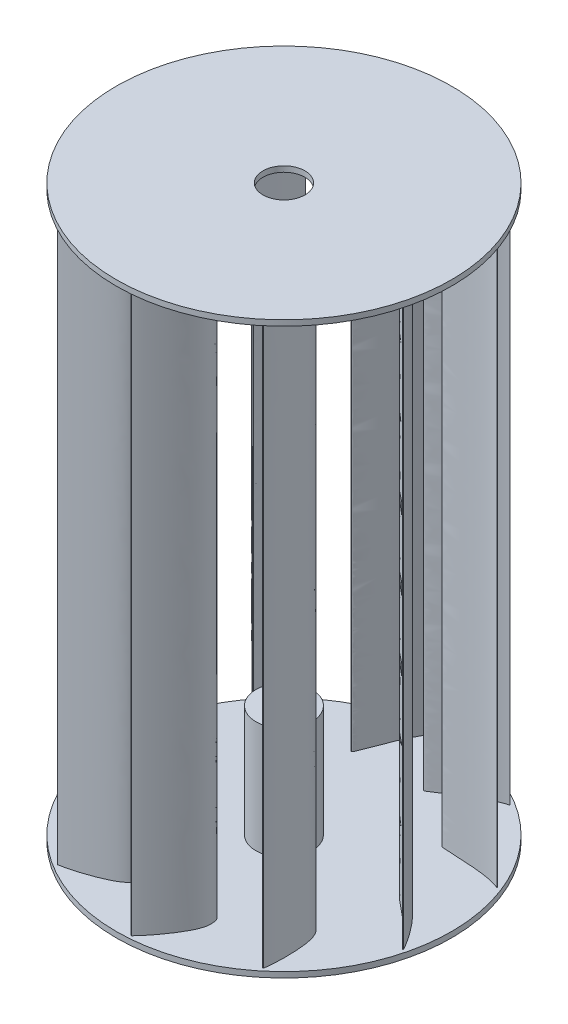
from build123d import *
from build123d.topology import SkipClean

# Parameters (mm, degrees)
SKETCH1_R               = 60
SKETCH1_R_2             = 4.05
BOSS_EXTRUDE1_DEPTH     = 2
BOSS_EXTRUDE3_DEPTH     = 200
SKETCH6_R               = 60
BOSS_EXTRUDE4_DEPTH     = 2
SKETCH5_3_W             = 16.38
SKETCH5_3_H             = 3.2
CUT_EXTRUDE1_DEPTH      = 2
BOSS_EXTRUDE5_START     = -2
BOSS_EXTRUDE5_OUTLINE_R = 10
BOSS_EXTRUDE5_DEPTH     = 21.5
SKETCH8_R               = 10
SKETCH8_R_2             = 4.05
BOSS_EXTRUDE6_DEPTH     = 20.5
SKETCH7_R               = 7.5
CUT_EXTRUDE2_DEPTH      = 2


with BuildPart() as part:
    # Sketch1 → Boss-Extrude1 (new body)
    with BuildSketch(Plane(origin=(0, 0, 0), x_dir=(1, 0, 0), z_dir=(0, 1, 0))):
        with Locations(Location((0, 0, 0), (0, 0, 270))):
            Circle(SKETCH1_R)
        with Locations(Location((0, 0, 0), (0, 0, 270))):
            Circle(SKETCH1_R_2, mode=Mode.SUBTRACT)
    extrude(amount=BOSS_EXTRUDE1_DEPTH)

    # Sketch5 → Boss-Extrude3 (add)
    with BuildSketch(Plane(origin=(0, 2, 0), x_dir=(1, 0, 0), z_dir=(0, 1, 0))):
        with BuildLine():
            Line((54.47988, 21.960658), (54.47988, 21.690876))
            add(Edge.make_bspline(
                [(31.771613, 24.834232), (31.766431, 24.791955), (31.759813, 24.712032), (31.900649, 24.569593), (32.095585, 24.506667), (32.496935, 24.424733), (37.402004, 24.192082), (47.209803, 23.66196), (51.917699, 22.649017), (53.887952, 21.95154), (54.47988, 21.690876)],
                knots=[0.499514, 0.499514, 0.499514, 0.499514, 0.508262, 0.515116, 0.518944, 0.522858, 0.530686, 0.624525, 0.81222, 0.898706, 0.898706, 0.898706, 0.898706], degree=3))
            add(Edge.make_bspline(
                [(54.47988, 21.960658), (54.371607, 22.017615), (53.429721, 22.499693), (50.737589, 23.658763), (44.529731, 25.7581), (38.137513, 27.152008), (34.495208, 26.829661), (32.006302, 25.472619), (31.803699, 25.09602), (31.771613, 24.834232)],
                knots=[0.027203, 0.027203, 0.027203, 0.027203, 0.031297, 0.062601, 0.125217, 0.250445, 0.375468, 0.445342, 0.499514, 0.499514, 0.499514, 0.499514], degree=3))
        make_face()
        with BuildLine():
            Line((31.166998, 49.789016), (31.325572, 49.570757))
            add(Edge.make_bspline(
                [(11.106579, 38.766201), (11.127237, 38.728953), (11.16886, 38.660403), (11.366523, 38.627949), (11.561216, 38.691621), (11.934075, 38.861243), (16.039108, 41.556151), (24.285382, 46.892154), (28.689543, 48.839898), (30.693478, 49.433713), (31.325572, 49.570757)],
                knots=[0.499514, 0.499514, 0.499514, 0.499514, 0.508262, 0.515116, 0.518944, 0.522858, 0.530686, 0.624525, 0.81222, 0.898706, 0.898706, 0.898706, 0.898706], degree=3))
            add(Edge.make_bspline(
                [(31.166998, 49.789016), (31.045925, 49.771453), (30.000565, 49.607836), (27.1413, 48.963148), (20.885078, 47.01266), (14.894346, 44.383104), (12.137131, 41.981426), (10.921213, 39.420614), (10.978663, 38.996852), (11.106579, 38.766201)],
                knots=[0.027203, 0.027203, 0.027203, 0.027203, 0.031297, 0.062601, 0.125217, 0.250445, 0.375468, 0.445342, 0.499514, 0.499514, 0.499514, 0.499514], degree=3))
        make_face()
        with BuildLine():
            Line((-4.050618, 58.599662), (-3.79404, 58.516294))
            add(Edge.make_bspline(
                [(-13.80079, 37.890799), (-13.762184, 37.872807), (-13.688217, 37.841815), (-13.509228, 37.931742), (-13.389144, 38.097692), (-13.187196, 38.454079), (-11.450182, 43.047184), (-7.915229, 52.211139), (-5.497044, 56.375597), (-4.224862, 58.033887), (-3.79404, 58.516294)],
                knots=[0.499514, 0.499514, 0.499514, 0.499514, 0.508262, 0.515116, 0.518944, 0.522858, 0.530686, 0.624525, 0.81222, 0.898706, 0.898706, 0.898706, 0.898706], degree=3))
            add(Edge.make_bspline(
                [(-4.050618, 58.599662), (-4.138246, 58.514288), (-4.887788, 57.767472), (-6.822043, 55.565274), (-10.736965, 50.309982), (-14.037954, 44.661362), (-14.856918, 41.097714), (-14.335409, 38.311275), (-14.03985, 38.002212), (-13.80079, 37.890799)],
                knots=[0.027203, 0.027203, 0.027203, 0.027203, 0.031297, 0.062601, 0.125217, 0.250445, 0.375468, 0.445342, 0.499514, 0.499514, 0.499514, 0.499514], degree=3))
        make_face()
        with BuildLine():
            Line((-54.47988, -21.960658), (-54.47988, -21.690876))
            add(Edge.make_bspline(
                [(-31.771613, -24.834232), (-31.766431, -24.791955), (-31.759813, -24.712032), (-31.900649, -24.569593), (-32.095585, -24.506667), (-32.496935, -24.424733), (-37.402004, -24.192082), (-47.209803, -23.66196), (-51.917699, -22.649017), (-53.887952, -21.95154), (-54.47988, -21.690876)],
                knots=[0.499514, 0.499514, 0.499514, 0.499514, 0.508262, 0.515116, 0.518944, 0.522858, 0.530686, 0.624525, 0.81222, 0.898706, 0.898706, 0.898706, 0.898706], degree=3))
            add(Edge.make_bspline(
                [(-54.47988, -21.960658), (-54.371607, -22.017615), (-53.429721, -22.499693), (-50.737589, -23.658763), (-44.529731, -25.7581), (-38.137513, -27.152008), (-34.495208, -26.829661), (-32.006302, -25.472619), (-31.803699, -25.09602), (-31.771613, -24.834232)],
                knots=[0.027203, 0.027203, 0.027203, 0.027203, 0.031297, 0.062601, 0.125217, 0.250445, 0.375468, 0.445342, 0.499514, 0.499514, 0.499514, 0.499514], degree=3))
        make_face()
        with BuildLine():
            Line((-31.166998, -49.789016), (-31.325572, -49.570757))
            add(Edge.make_bspline(
                [(-11.106579, -38.766201), (-11.127237, -38.728953), (-11.16886, -38.660403), (-11.366523, -38.627949), (-11.561216, -38.691621), (-11.934075, -38.861243), (-16.039108, -41.556151), (-24.285382, -46.892154), (-28.689543, -48.839898), (-30.693478, -49.433713), (-31.325572, -49.570757)],
                knots=[0.499514, 0.499514, 0.499514, 0.499514, 0.508262, 0.515116, 0.518944, 0.522858, 0.530686, 0.624525, 0.81222, 0.898706, 0.898706, 0.898706, 0.898706], degree=3))
            add(Edge.make_bspline(
                [(-31.166998, -49.789016), (-31.045925, -49.771453), (-30.000565, -49.607836), (-27.1413, -48.963148), (-20.885078, -47.01266), (-14.894346, -44.383104), (-12.137131, -41.981426), (-10.921213, -39.420614), (-10.978663, -38.996852), (-11.106579, -38.766201)],
                knots=[0.027203, 0.027203, 0.027203, 0.027203, 0.031297, 0.062601, 0.125217, 0.250445, 0.375468, 0.445342, 0.499514, 0.499514, 0.499514, 0.499514], degree=3))
        make_face()
        with BuildLine():
            Line((37.721036, -45.027228), (37.464457, -45.110596))
            add(Edge.make_bspline(
                [(33.436726, -22.5424), (33.394918, -22.550536), (33.316861, -22.568939), (33.224914, -22.746899), (33.225306, -22.951738), (33.271406, -23.358764), (34.565892, -28.095655), (37.092492, -37.587243), (37.583947, -42.377735), (37.529448, -44.467089), (37.464457, -45.110596)],
                knots=[0.499514, 0.499514, 0.499514, 0.499514, 0.508262, 0.515116, 0.518944, 0.522858, 0.530686, 0.624525, 0.81222, 0.898706, 0.898706, 0.898706, 0.898706], degree=3))
            add(Edge.make_bspline(
                [(37.721036, -45.027228), (37.741747, -44.906654), (37.909172, -43.861897), (38.179598, -40.943355), (38.257853, -34.3906), (37.608234, -27.880499), (36.17613, -24.516071), (34.116392, -22.56833), (33.695616, -22.492018), (33.436726, -22.5424)],
                knots=[0.027203, 0.027203, 0.027203, 0.027203, 0.031297, 0.062601, 0.125217, 0.250445, 0.375468, 0.445342, 0.499514, 0.499514, 0.499514, 0.499514], degree=3))
        make_face()
        with BuildLine():
            Line((56.9833, -14.255924), (56.824726, -14.474183))
            add(Edge.make_bspline(
                [(40.30097, 1.41643), (40.271928, 1.385274), (40.219596, 1.324504), (40.249812, 1.126487), (40.370531, 0.960999), (40.64707, 0.658805), (44.478606, -2.412541), (52.101684, -8.606299), (55.315059, -12.193018), (56.499061, -13.915375), (56.824726, -14.474183)],
                knots=[0.499514, 0.499514, 0.499514, 0.499514, 0.508262, 0.515116, 0.518944, 0.522858, 0.530686, 0.624525, 0.81222, 0.898706, 0.898706, 0.898706, 0.898706], degree=3))
            add(Edge.make_bspline(
                [(56.9833, -14.255924), (56.929183, -14.146204), (56.45054, -13.202568), (54.953844, -10.682466), (51.165541, -5.335179), (46.813446, -0.450232), (43.677289, 1.429877), (40.866072, 1.794949), (40.480803, 1.609361), (40.30097, 1.41643)],
                knots=[0.027203, 0.027203, 0.027203, 0.027203, 0.031297, 0.062601, 0.125217, 0.250445, 0.375468, 0.445342, 0.499514, 0.499514, 0.499514, 0.499514], degree=3))
        make_face()
        with BuildLine():
            add(Edge.make_bspline(
                [(-37.721036, 45.027228), (-37.741747, 44.906654), (-37.909172, 43.861897), (-38.179598, 40.943355), (-38.257853, 34.3906), (-37.608234, 27.880499), (-36.17613, 24.516071), (-34.116392, 22.56833), (-33.695616, 22.492018), (-33.436726, 22.5424)],
                knots=[0.027203, 0.027203, 0.027203, 0.027203, 0.031297, 0.062601, 0.125217, 0.250445, 0.375468, 0.445342, 0.499514, 0.499514, 0.499514, 0.499514], degree=3))
            add(Edge.make_bspline(
                [(-33.436726, 22.5424), (-33.394918, 22.550536), (-33.316861, 22.568939), (-33.224914, 22.746899), (-33.225306, 22.951738), (-33.271406, 23.358764), (-34.565892, 28.095655), (-37.092492, 37.587243), (-37.583947, 42.377735), (-37.529448, 44.467089), (-37.464457, 45.110596)],
                knots=[0.499514, 0.499514, 0.499514, 0.499514, 0.508262, 0.515116, 0.518944, 0.522858, 0.530686, 0.624525, 0.81222, 0.898706, 0.898706, 0.898706, 0.898706], degree=3))
            Line((-37.464457, 45.110596), (-37.721036, 45.027228))
        make_face()
        with BuildLine():
            add(Edge.make_bspline(
                [(-56.9833, 14.255924), (-56.929183, 14.146204), (-56.45054, 13.202568), (-54.953844, 10.682466), (-51.165541, 5.335179), (-46.813446, 0.450232), (-43.677289, -1.429877), (-40.866072, -1.794949), (-40.480803, -1.609361), (-40.30097, -1.41643)],
                knots=[0.027203, 0.027203, 0.027203, 0.027203, 0.031297, 0.062601, 0.125217, 0.250445, 0.375468, 0.445342, 0.499514, 0.499514, 0.499514, 0.499514], degree=3))
            add(Edge.make_bspline(
                [(-40.30097, -1.41643), (-40.271928, -1.385274), (-40.219596, -1.324504), (-40.249812, -1.126487), (-40.370531, -0.960999), (-40.64707, -0.658805), (-44.478606, 2.412541), (-52.101684, 8.606299), (-55.315059, 12.193018), (-56.499061, 13.915375), (-56.824726, 14.474183)],
                knots=[0.499514, 0.499514, 0.499514, 0.499514, 0.508262, 0.515116, 0.518944, 0.522858, 0.530686, 0.624525, 0.81222, 0.898706, 0.898706, 0.898706, 0.898706], degree=3))
            Line((-56.824726, 14.474183), (-56.9833, 14.255924))
        make_face()
        with BuildLine():
            add(Edge.make_bspline(
                [(13.80079, -37.890799), (13.762184, -37.872807), (13.688217, -37.841815), (13.509228, -37.931742), (13.389144, -38.097692), (13.187196, -38.454079), (11.450182, -43.047184), (7.915229, -52.211139), (5.497044, -56.375597), (4.224862, -58.033887), (3.79404, -58.516294)],
                knots=[0.499514, 0.499514, 0.499514, 0.499514, 0.508262, 0.515116, 0.518944, 0.522858, 0.530686, 0.624525, 0.81222, 0.898706, 0.898706, 0.898706, 0.898706], degree=3))
            Line((3.79404, -58.516294), (4.050618, -58.599662))
            add(Edge.make_bspline(
                [(4.050618, -58.599662), (4.138246, -58.514288), (4.887788, -57.767472), (6.822043, -55.565274), (10.736965, -50.309982), (14.037954, -44.661362), (14.856918, -41.097714), (14.335409, -38.311275), (14.03985, -38.002212), (13.80079, -37.890799)],
                knots=[0.027203, 0.027203, 0.027203, 0.027203, 0.031297, 0.062601, 0.125217, 0.250445, 0.375468, 0.445342, 0.499514, 0.499514, 0.499514, 0.499514], degree=3))
        make_face()
    extrude(amount=BOSS_EXTRUDE3_DEPTH)

    # Sketch6 → Boss-Extrude4 (add)
    with BuildSketch(Plane(origin=(0, 202, 0), x_dir=(1, 0, 0), z_dir=(0, 1, 0))):
        with Locations(Location((0, 0, 0), (0, 0, 270))):
            Circle(SKETCH6_R)
    extrude(amount=BOSS_EXTRUDE4_DEPTH)

    # Sketch5<3> → Cut-Extrude1 (cut)
    with BuildSketch(Plane(origin=(0, 2, 0), x_dir=(1, 0, 0), z_dir=(0, 1, 0))):
        Rectangle(SKETCH5_3_W, SKETCH5_3_H)
    extrude(amount=-CUT_EXTRUDE1_DEPTH, mode=Mode.SUBTRACT)

    # Boss-Extrude5: read off the stored shape, not the designer's step
    # Boss-Extrude5 outline → Boss-Extrude5 (add)
    with SkipClean():  # the faces are left unmerged after this step: merging them gives an invalid solid
        with BuildSketch(Plane(origin=(0, 2, 0), x_dir=(1, 0, 0), z_dir=(0, 1, 0)).offset(BOSS_EXTRUDE5_START)):
            Circle(BOSS_EXTRUDE5_OUTLINE_R)
            with BuildLine():
                Line((-8.19, 1.6), (-3.720551, 1.6))
                ThreePointArc((-3.720551, 1.6), (0, 4.05), (3.720551, 1.6))
                Line((3.720551, 1.6), (8.19, 1.6))
                Line((8.19, 1.6), (8.19, -1.6))
                Line((8.19, -1.6), (3.720551, -1.6))
                ThreePointArc((3.720551, -1.6), (0, -4.05), (-3.720551, -1.6))
                Line((-3.720551, -1.6), (-8.19, -1.6))
                Line((-8.19, -1.6), (-8.19, 1.6))
            make_face(mode=Mode.SUBTRACT)
        extrude(amount=BOSS_EXTRUDE5_DEPTH)

    # Sketch8 → Boss-Extrude6 (add)
    with BuildSketch(Plane(origin=(0, 21.5, 0), x_dir=(1, 0, 0), z_dir=(0, 1, 0))):
        with Locations(Location((0, 0, 0), (0, 0, 270))):
            Circle(SKETCH8_R)
        with Locations(Location((0, 0, 0), (0, 0, 23.269824))):
            Circle(SKETCH8_R_2, mode=Mode.SUBTRACT)
    extrude(amount=BOSS_EXTRUDE6_DEPTH)

    # Sketch7 → Cut-Extrude2 (cut)
    with SkipClean():  # the faces are left unmerged after this step: merging them gives an invalid solid
        with BuildSketch(Plane(origin=(0, 204, 0), x_dir=(1, 0, 0), z_dir=(0, 1, 0))):
            with Locations(Location((0, 0, 0), (0, 0, 270))):
                Circle(SKETCH7_R)
        extrude(amount=-CUT_EXTRUDE2_DEPTH, mode=Mode.SUBTRACT)


solid = part.part
